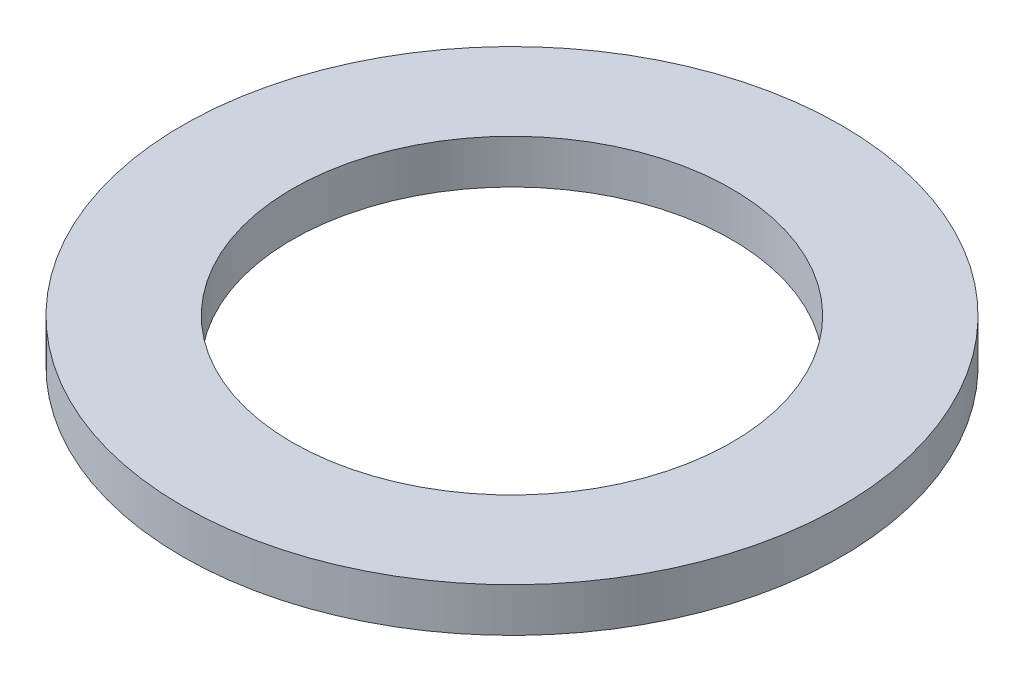
from build123d import *

# Parameters (mm, degrees)
SKETCH1_R           = 45
BOSS_EXTRUDE1_DEPTH = 6
SKETCH2_R           = 30
CUT_EXTRUDE1_DEPTH  = 64.921827258


with BuildPart() as part:
    # Sketch1 → Boss-Extrude1 (new body)
    with BuildSketch(Plane(origin=(0, 0, 0), x_dir=(1, 0, 0), z_dir=(0, 1, 0))):
        Circle(SKETCH1_R)
    extrude(amount=BOSS_EXTRUDE1_DEPTH)

    # Sketch2 → Cut-Extrude1 (cut, through all)
    with BuildSketch(Plane(origin=(0, 0, 0), x_dir=(1, 0, 0), z_dir=(0, 1, 0))):
        Circle(SKETCH2_R)
    extrude(amount=CUT_EXTRUDE1_DEPTH, mode=Mode.SUBTRACT)


solid = part.part
